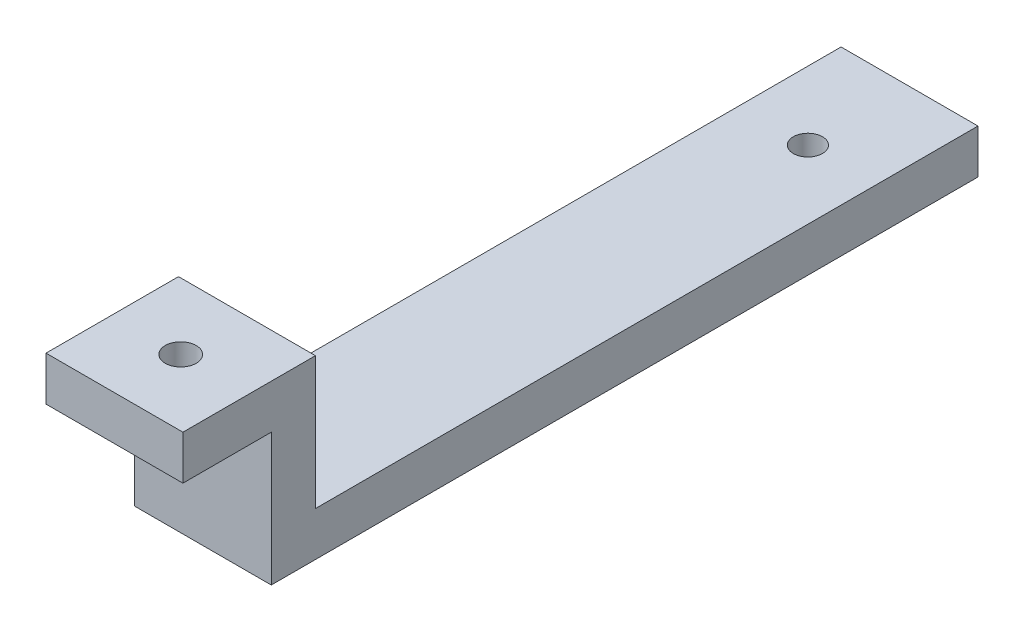
from build123d import *

# Parameters (mm, degrees)
EXTRUDE_THIN1_DEPTH = 31
SKETCH6_R           = 3.5
CUT_EXTRUDE1_DEPTH  = 10
SKETCH7_R           = 3.302
CUT_EXTRUDE3_DEPTH  = 10.16


with BuildPart() as part:
    # Sketch1 → Extrude-Thin1 (new body)
    with BuildSketch(Plane(origin=(0, 0, 0), x_dir=(0, 0, -1), z_dir=(1, 0, 0))):
        Polygon((0, 0), (30, 0), (30, -29.972), (180, -29.972), (180, -39.972), (20, -39.972), (20, -10), (0, -10), align=None)
    extrude(amount=EXTRUDE_THIN1_DEPTH)

    # Sketch6 → Cut-Extrude1 (cut)
    with BuildSketch(Plane(origin=(0, 0, 0), x_dir=(1, 0, 0), z_dir=(0, 1, 0))):
        with Locations((15.5, 15)):
            Circle(SKETCH6_R)
    extrude(amount=-CUT_EXTRUDE1_DEPTH, mode=Mode.SUBTRACT)

    # Sketch7 → Cut-Extrude3 (cut)
    with BuildSketch(Plane(origin=(0, -29.972, 0), x_dir=(1, 0, 0), z_dir=(0, 1, 0))):
        with Locations((15.494, 157)):
            Circle(SKETCH7_R)
    extrude(amount=-CUT_EXTRUDE3_DEPTH, mode=Mode.SUBTRACT)


solid = part.part
